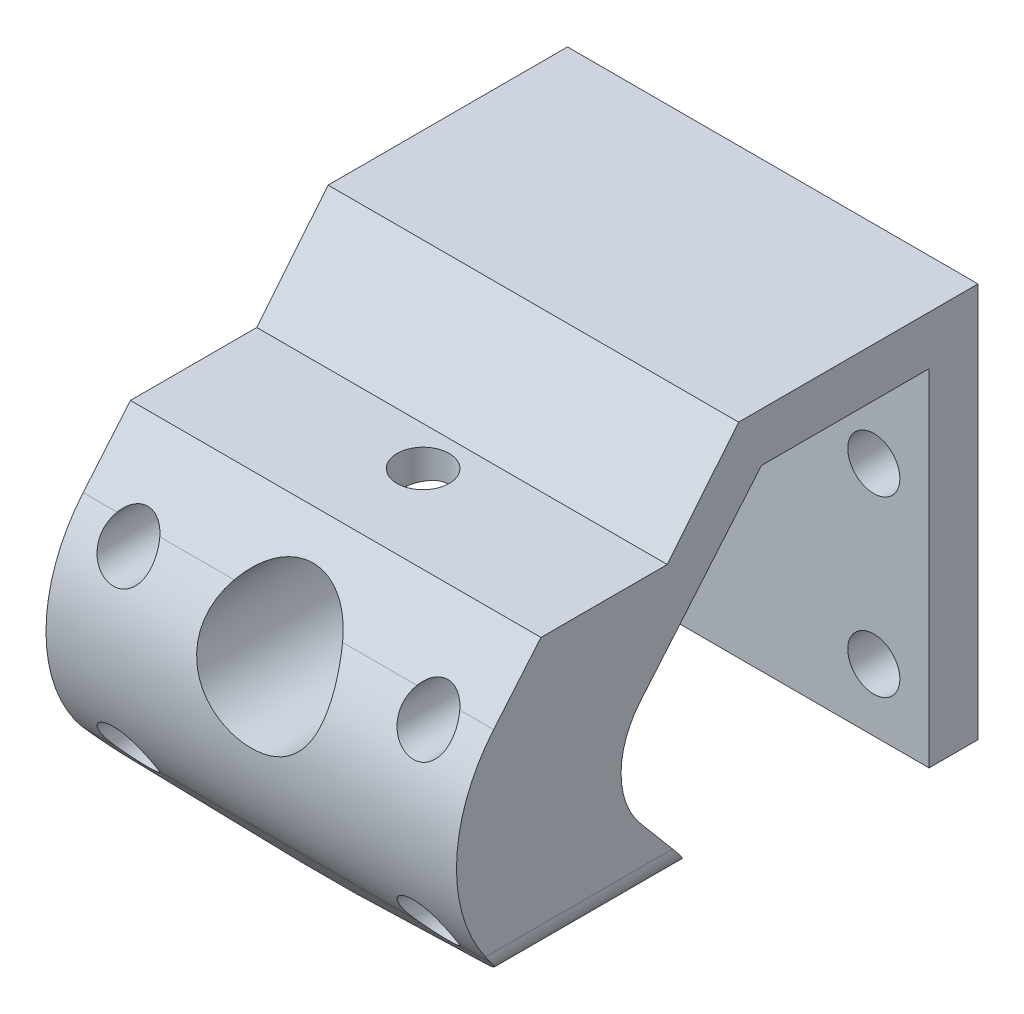
from build123d import *
from OCP.BRepFilletAPI import BRepFilletAPI_MakeChamfer

# Parameters (mm, degrees)
EXTRUDE_1_DEPTH     = 26
SKETCH_2_R          = 1.65
CUT_EXTRUDE_1_DEPTH = 45.819078563
SKETCH_3_W          = 28.1444964
SKETCH_3_H          = 6.1
CUT_EXTRUDE_2_DEPTH = 35.940261345
CUT_EXTRUDE_4_REACH = 46.819
SKETCH_5_R          = 4.1
SKETCH_6_R          = 1.65
CUT_EXTRUDE_5_DEPTH = 41.050210522
CHAMFER_1_SIZE      = 2
CHAMFER_1_SIZE2     = 11.342563639
FILLET_1_R          = 2


with BuildPart() as part:
    # 草图1 → 凸台-拉伸1 (new body)
    with BuildSketch(Plane(origin=(0, 0, 0), x_dir=(0, 0, -1), z_dir=(1, 0, 0))):
        with BuildLine():
            Line((17.407451211, 15.55), (2.245544981, 15.55))
            Line((2.245544981, 15.55), (-2.273793452, 10))
            Line((-2.273793452, 10), (-10.273793452, 10))
            Line((-10.273793452, 10), (-13.270509165, 6.44212097))
            ThreePointArc((-13.270509165, 6.44212097), (-15.622040206, 0), (-13.270509165, -6.44212097))
            Line((-13.270509165, -6.44212097), (-10.273793452, -10))
            Line((-10.273793452, -10), (-2.273793452, -10))
            Line((-2.273793452, -10), (2.245544981, -15.55))
            Line((2.245544981, -15.55), (17.407451211, -15.55))
            Line((17.407451211, -15.55), (17.407451211, 15.55))
        make_face()
        with BuildLine():
            Line((3.687588487, 12.45), (14.307451211, 12.45))
            Line((14.307451211, 12.45), (14.307451211, -12.45))
            Line((14.307451211, -12.45), (3.687588487, -12.45))
            Line((3.687588487, -12.45), (-3.977203858, -3.349902904))
            ThreePointArc((-3.977203858, -3.349902904), (-5.2, 0), (-3.977203858, 3.349902904))
            Line((-3.977203858, 3.349902904), (3.687588487, 12.45))
        make_face(mode=Mode.SUBTRACT)
    extrude(amount=EXTRUDE_1_DEPTH)

    # 草图2 → 切除-拉伸1 (cut, through all)
    with BuildSketch(Plane(origin=(0, 0, -17.407451211), x_dir=(-1, 0, 0), z_dir=(0, 0, -1))):
        with Locations((-22.5, 5.5)):
            Circle(SKETCH_2_R)
        with Locations(Location((-22.5, -5.5, 0), (0, 0, 325.181239638))):
            Circle(SKETCH_2_R)
        with Locations(Location((-3.5, -5.5, 0), (0, 0, 325.181239638))):
            Circle(SKETCH_2_R)
        with Locations(Location((-3.5, 5.5, 0), (0, 0, 180))):
            Circle(SKETCH_2_R)
    extrude(amount=-CUT_EXTRUDE_1_DEPTH, mode=Mode.SUBTRACT)

    # 草图3 → 切除-拉伸2 (cut, through all)
    with BuildSketch(Plane.ZY):
        with Locations((-3.335203011, -12.5)):
            Rectangle(SKETCH_3_W, SKETCH_3_H)
    extrude(amount=-CUT_EXTRUDE_2_DEPTH, mode=Mode.SUBTRACT)

    # 草图5 → 切除-拉伸4 (cut, up to next)
    with BuildSketch(Plane.XY.offset(15.622040206), mode=Mode.PRIVATE) as cut_extrude_4_sk1:
        with Locations(Location((13, 4.2, 0), (0, 0, 348.033440949))):
            Circle(SKETCH_5_R)
    cut_extrude_4_tool1 = extrude(cut_extrude_4_sk1.sketch, amount=-CUT_EXTRUDE_4_REACH, mode=Mode.PRIVATE) & part.part
    add(cut_extrude_4_tool1.solids().sort_by_distance((13, 4.2, 15.62204))[0], mode=Mode.SUBTRACT)

    # 草图6 → 切除-拉伸5 (cut, through all)
    with BuildSketch(Plane.XZ.offset(9.45)):
        with Locations(Location((13, 4.737045189, 0), (0, 0, 270))):
            Circle(SKETCH_6_R)
    extrude(amount=-CUT_EXTRUDE_5_DEPTH, mode=Mode.SUBTRACT)

    # 倒角1: one chamfer whose edges measure the first distance from different faces: ONE call of the kernel's chamfer builder (chamfer() names one face for all edges)
    chamfer_1_edges_1 = [part.edges().sort_by_distance(p)[0] for p in [
        (0, -9.45, 4.78814218),
    ]]
    chamfer_1_side_1 = [part.faces().sort_by_distance(p)[0] for p in [
        (0, -9.035760057, -15.857451211),
    ]]
    chamfer_1_edges_2 = [part.edges().sort_by_distance(p)[0] for p in [
        (26, -9.45, 4.78814218),
    ]]
    chamfer_1_side_2 = [part.faces().sort_by_distance(p)[0] for p in [
        (26, -9.035760057, -15.857451211),
    ]]
    chamfer_1 = BRepFilletAPI_MakeChamfer(part.part.solid().wrapped)
    for e in chamfer_1_edges_1:
        chamfer_1.Add(CHAMFER_1_SIZE, CHAMFER_1_SIZE2, e.wrapped, chamfer_1_side_1[0].wrapped)  # the first distance lies on this face
    for e in chamfer_1_edges_2:
        chamfer_1.Add(CHAMFER_1_SIZE, CHAMFER_1_SIZE2, e.wrapped, chamfer_1_side_2[0].wrapped)  # the first distance lies on this face
    add(Compound.cast(chamfer_1.Shape()), mode=Mode.REPLACE)

    # 圆角1
    # the kernel refuses this fillet: 2 mm, written as the material it takes off along each edge
    with BuildSketch(Plane(origin=(26, -7.45, -3.671707212), x_dir=(-0.9848077530122086, -0.17364817766692747, 0), z_dir=(0, 0, 1))) as fillet_1_piece_1:
        with BuildLine():
            CenterArc((FILLET_1_R * 0.839099631177, -FILLET_1_R), FILLET_1_R, 90, 80)
            Line((-FILLET_1_R * 0.145708121835, -FILLET_1_R * 0.826351822333), (0, 0))
            Line((0, 0), (FILLET_1_R * 0.839099631177, 0))
        make_face()
    extrude(amount=20.288802329, mode=Mode.SUBTRACT)
    with BuildSketch(Plane(origin=(0, -7.45, 16.617095117), x_dir=(0, 1, 0), z_dir=(0, 0, -1))) as fillet_1_piece_2:
        with BuildLine():
            CenterArc((FILLET_1_R * 0.839099631177, FILLET_1_R), FILLET_1_R, 190, 80)
            Line((-FILLET_1_R * 0.145708121835, FILLET_1_R * 0.826351822333), (0, 0))
            Line((0, 0), (FILLET_1_R * 0.839099631177, 0))
        make_face()
    extrude(amount=20.288802329, mode=Mode.SUBTRACT)


solid = part.part
